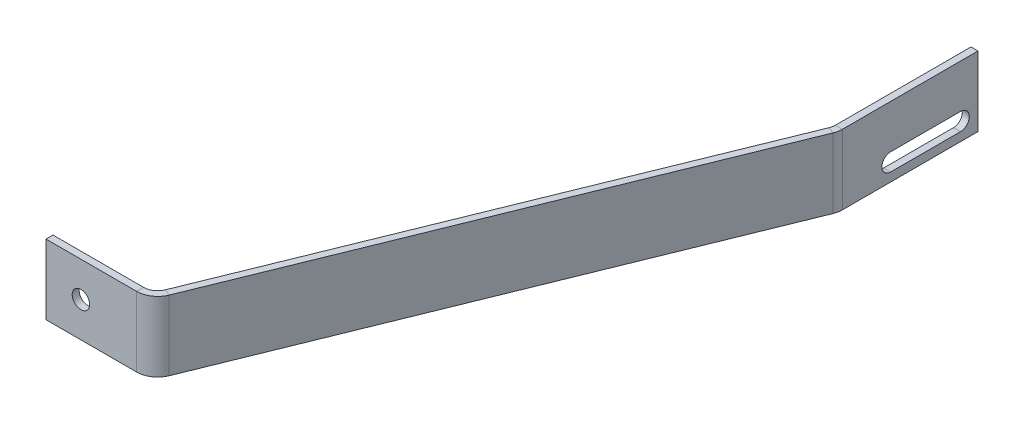
from build123d import *

# Parameters (mm, degrees)
BOSS_EXTRUDE1_DEPTH  = 20
CONVERT_SOLID2_DEPTH = 20
SKETCH8_R            = 2.5
CUT_EXTRUDE1_DEPTH   = 20
CUT_EXTRUDE2_DEPTH   = 10


# Read off the part's stored shape, not the designer's step: Convert-Solid2
with BuildPart() as part:
    # Sketch1 → Boss-Extrude1 (new body)
    with BuildSketch(Plane(origin=(0, 0, 0), x_dir=(1, 0, 0), z_dir=(0, 1, 0))):
        Polygon((0, 0), (30, 0), (86.75, 140), (86.75, 180), (81.75, 180), (81.75, 140.974868952), (26.631615621, 5), (0, 5), align=None)
    extrude(amount=BOSS_EXTRUDE1_DEPTH)

    # Convert-Solid2 outline → Convert-Solid2 (cut)
    with BuildSketch(Plane(origin=(0, 0, 0), x_dir=(1, 0, 0), z_dir=(0, 1, 0))):
        with BuildLine():
            Line((30, 0), (31.51846779, 3.745999834))
            ThreePointArc((31.51846779, 3.745999834), (29.310251306, 1.023856865), (25.957938746, 0))
            Line((25.957938746, 0), (30, 0))
        make_face()
        with BuildLine():
            ThreePointArc((86.75, 141.169842742), (86.639107499, 140.021621131), (86.310529044, 138.915842576))
            Line((86.310529044, 138.915842576), (86.75, 140))
            Line((86.75, 140), (86.75, 141.169842742))
        make_face()
        with BuildLine():
            Line((0, 5), (0, 2))
            Line((0, 2), (25.957938746, 2))
            ThreePointArc((25.957938746, 2), (28.192813786, 2.682571243), (29.664958108, 4.497333223))
            Line((29.664958108, 4.497333223), (84.457019363, 139.667175965))
            ThreePointArc((84.457019363, 139.667175965), (84.676071666, 140.404361668), (84.75, 141.169842742))
            Line((84.75, 141.169842742), (84.75, 180))
            Line((84.75, 180), (81.75, 180))
            Line((81.75, 180), (81.75, 140.974868952))
            Line((81.75, 140.974868952), (26.631615621, 5))
            Line((26.631615621, 5), (0, 5))
        make_face()
    extrude(amount=CONVERT_SOLID2_DEPTH, mode=Mode.SUBTRACT)

    # Sketch8 → Cut-Extrude1 (cut)
    with BuildSketch(Plane.XY):
        with Locations((10, 10)):
            Circle(SKETCH8_R)
    extrude(amount=-CUT_EXTRUDE1_DEPTH, mode=Mode.SUBTRACT)

    # Sketch9 → Cut-Extrude2 (cut)
    with BuildSketch(Plane(origin=(86.75, 0, -320.372504423), x_dir=(0, 0, 1), z_dir=(-1, 0, 0))):
        with BuildLine():
            Line((145.372504423, 7.5), (165.372504423, 7.5))
            ThreePointArc((165.372504423, 7.5), (167.872504423, 5), (165.372504423, 2.5))
            Line((165.372504423, 2.5), (145.372504423, 2.5))
            ThreePointArc((145.372504423, 2.5), (142.872504423, 5), (145.372504423, 7.5))
        make_face()
    extrude(amount=CUT_EXTRUDE2_DEPTH, mode=Mode.SUBTRACT)


solid = part.part
